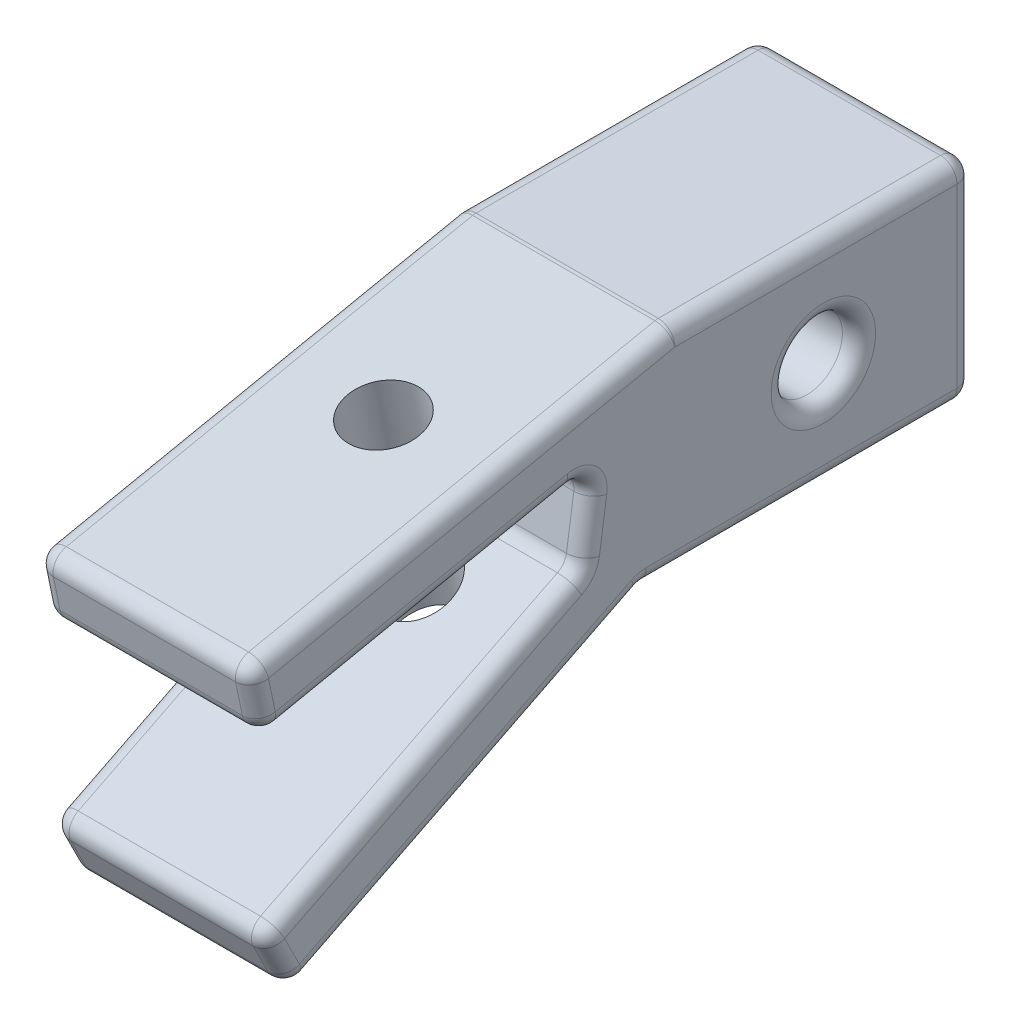
from build123d import *

# Parameters (mm, degrees)
SKETCH1_R           = 2.15
BOSS_EXTRUDE1_DEPTH = 13
FILLET1_R           = 1
SKETCH3_R           = 2.15
CUT_EXTRUDE1_DEPTH  = 23


with BuildPart() as part:
    # Sketch1 → Boss-Extrude1 (new body)
    with BuildSketch(Plane(origin=(0, 0, 0), x_dir=(0, 0, -1), z_dir=(1, 0, 0))):
        Polygon((10.085411522, -23.627690808), (35.680454717, -18.353601532), (53.805469924, -18.353601532), (53.805469924, -31.012613107), (33.820918695, -31.012613107), (12.686428662, -41.615982232), (10.892687141, -38.040721213), (30.16601409, -28.371114821), (30.892687141, -23.424202018), (10.892687141, -27.54538223), align=None)
        with Locations((44.742962321, -24.683107319)):
            Circle(SKETCH1_R, mode=Mode.SUBTRACT)
    extrude(amount=BOSS_EXTRUDE1_DEPTH)

    # Fillet1
    fillet1_edges = [part.edges().sort_by_distance(p)[0] for p in [
        (6.5, -23.424202018, -30.892687141),
        (6.5, -28.371114821, -30.16601409),
        (6.5, -27.54538223, -10.892687141),
        (6.5, -23.627690808, -10.085411522),
        (6.5, -18.353601532, -35.680454717),
        (6.5, -18.353601532, -53.805469924),
        (6.5, -31.012613107, -53.805469924),
        (6.5, -31.012613107, -33.820918695),
        (6.5, -38.040721213, -10.892687141),
        (6.5, -41.615982232, -12.686428662),
        (0, -24.683107319, -42.592962321),
        (0, -25.484792124, -20.892687141),
        (0, -25.89765842, -30.529350615),
        (0, -33.205918017, -20.529350615),
        (0, -39.828351723, -11.789557901),
        (0, -36.31429767, -23.253673679),
        (0, -31.012613107, -43.81319431),
        (0, -24.683107319, -53.805469924),
        (0, -18.353601532, -44.742962321),
        (0, -20.99064617, -22.88293312),
        (0, -25.586536519, -10.489049331),
        (13, -24.683107319, -42.592962321),
        (13, -20.99064617, -22.88293312),
        (13, -18.353601532, -44.742962321),
        (13, -24.683107319, -53.805469924),
        (13, -31.012613107, -43.81319431),
        (13, -36.31429767, -23.253673679),
        (13, -39.828351723, -11.789557901),
        (13, -33.205918017, -20.529350615),
        (13, -25.89765842, -30.529350615),
        (13, -25.484792124, -20.892687141),
        (13, -25.586536519, -10.489049331),
    ]]
    fillet(fillet1_edges, radius=FILLET1_R)

    # Sketch3 → Cut-Extrude1 (cut)
    with BuildSketch(Plane(origin=(0, -24.658857836, -5.081179848), x_dir=(1, 0, 0), z_dir=(0, 0.9794228554459581, 0.20181890454089338))):
        with Locations((6.5, 20.030838197)):
            Circle(SKETCH3_R)
    extrude(amount=-CUT_EXTRUDE1_DEPTH, mode=Mode.SUBTRACT)


solid = part.part
